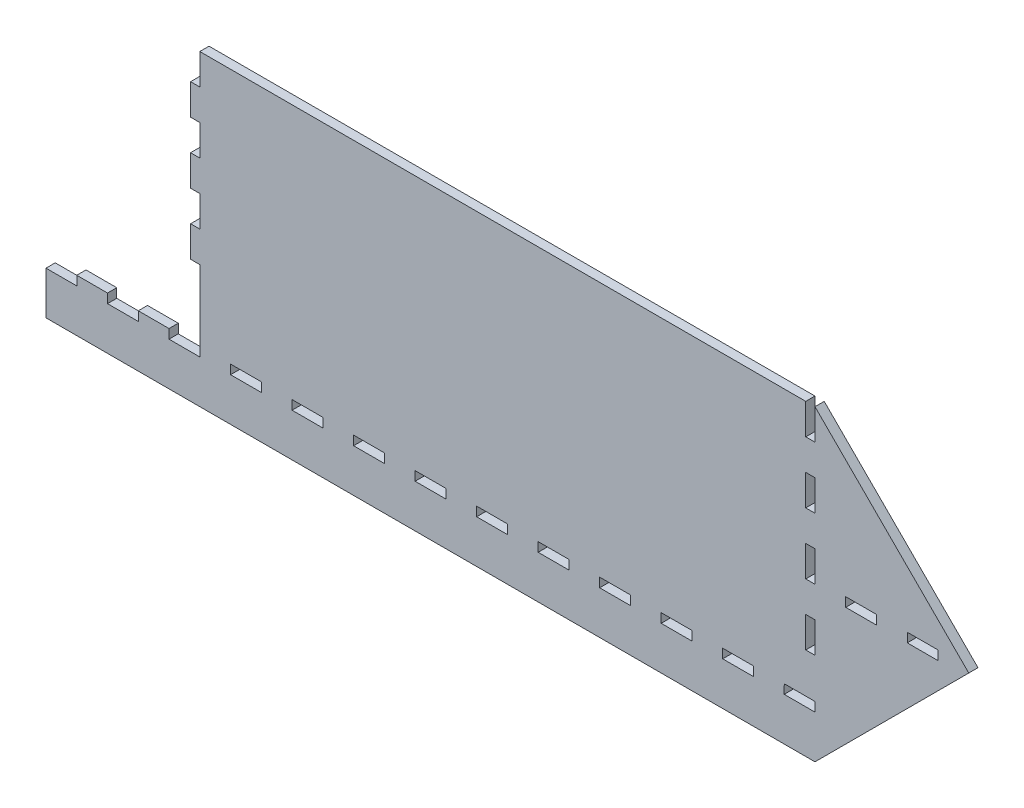
from build123d import *

# Parameters (mm, degrees)
SKETCH1_W           = 10
SKETCH1_H           = 3
SKETCH1_W_2         = 3
SKETCH1_H_2         = 10
BOSS_EXTRUDE1_DEPTH = 3


with BuildPart() as part:
    # Sketch1 → Boss-Extrude1 (new body)
    with BuildSketch(Plane.XY):
        Polygon((-112.631023813, -53.728350242), (-112.631023813, -67.728350242), (137.368976187, -67.728350242), (187.368976187, -17.728350242), (137.368976187, 32.271649758), (137.368976187, 22.271649758), (134.368976187, 22.271649758), (134.368976187, 32.271649758), (-62.631023813, 32.271649758), (-62.631023813, 22.271649758), (-65.631023813, 22.271649758), (-65.631023813, 12.271649758), (-62.631023813, 12.271649758), (-62.631023813, 2.271649758), (-65.631023813, 2.271649758), (-65.631023813, -7.728350242), (-62.631023813, -7.728350242), (-62.631023813, -17.728350242), (-65.631023813, -17.728350242), (-65.631023813, -27.728350242), (-62.631023813, -27.728350242), (-62.631023813, -50.728350242), (-62.631023813, -53.728350242), (-72.631023813, -53.728350242), (-72.631023813, -50.728350242), (-82.631023813, -50.728350242), (-82.631023813, -53.728350242), (-92.631023813, -53.728350242), (-92.631023813, -50.728350242), (-102.631023813, -50.728350242), (-102.631023813, -53.728350242), align=None)
        with Locations((-47.631023813, -52.228350242)):
            Rectangle(SKETCH1_W, SKETCH1_H, mode=Mode.SUBTRACT)
        with Locations((-27.631023813, -52.228350242)):
            Rectangle(SKETCH1_W, SKETCH1_H, mode=Mode.SUBTRACT)
        with Locations((-7.631023813, -52.228350242)):
            Rectangle(SKETCH1_W, SKETCH1_H, mode=Mode.SUBTRACT)
        with Locations((12.368976187, -52.228350242)):
            Rectangle(SKETCH1_W, SKETCH1_H, mode=Mode.SUBTRACT)
        Polygon((27.368976187, -50.728350242), (37.371405326, -50.728350242), (37.368976187, -53.728350242), (27.368976187, -53.728350242), align=None, mode=Mode.SUBTRACT)
        Polygon((47.371408604, -50.728350242), (57.373834464, -50.728350242), (57.368979465, -53.728350242), (47.368979465, -53.728350242), align=None, mode=Mode.SUBTRACT)
        Polygon((67.373847559, -50.728350242), (77.376263603, -50.728350242), (77.36899256, -53.728350242), (67.36899256, -53.728350242), align=None, mode=Mode.SUBTRACT)
        Polygon((87.376292974, -50.728350242), (97.378692742, -50.728350242), (97.369021931, -53.728350242), (87.369021931, -53.728350242), align=None, mode=Mode.SUBTRACT)
        Polygon((107.3787447, -50.728350242), (117.381121881, -50.728350242), (117.369073889, -53.728350242), (107.369073889, -53.728350242), align=None, mode=Mode.SUBTRACT)
        Polygon((127.381202522, -50.728350242), (137.381202522, -50.728350242), (137.36915453, -53.728350242), (127.36915453, -53.728350242), align=None, mode=Mode.SUBTRACT)
        with Locations((135.868976187, -32.728350242)):
            Rectangle(SKETCH1_W_2, SKETCH1_H_2, mode=Mode.SUBTRACT)
        with Locations((135.868976187, -12.728350242)):
            Rectangle(SKETCH1_W_2, SKETCH1_H_2, mode=Mode.SUBTRACT)
        with Locations((152.368976187, -17.728350242)):
            Rectangle(SKETCH1_W, SKETCH1_H, mode=Mode.SUBTRACT)
        with Locations((172.368976187, -17.728350242)):
            Rectangle(SKETCH1_W, SKETCH1_H, mode=Mode.SUBTRACT)
        with Locations((135.868976187, 7.271649758)):
            Rectangle(SKETCH1_W_2, SKETCH1_H_2, mode=Mode.SUBTRACT)
    extrude(amount=BOSS_EXTRUDE1_DEPTH)


solid = part.part
